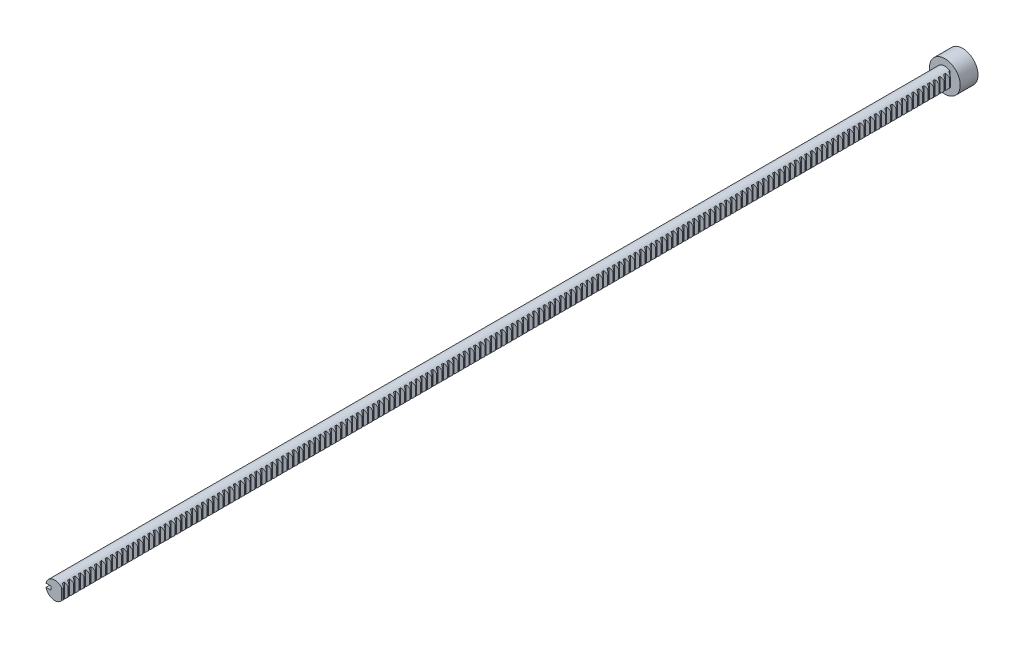
from build123d import *

# Parameters (mm, degrees)
BOSS_EXTRUDE1_DEPTH = 250
CUT_EXTRUDE3_DEPTH  = 255.066920318
LPATTERN1_COUNT     = 200
LPATTERN1_PITCH     = 3
SKETCH3_R           = 8.647763434
BOSS_EXTRUDE2_DEPTH = 10


with BuildPart() as part:
    # Sketch1 → Boss-Extrude1 (new, symmetric)
    with BuildSketch(Plane.XY):
        with BuildLine():
            Line((-2, 41), (-4.898979486, 41))
            ThreePointArc((-4.898979486, 41), (5, 40), (-4.898979486, 39))
            Line((-4.898979486, 39), (-2, 39))
            Line((-2, 39), (-2, 41))
        make_face()
    extrude(amount=BOSS_EXTRUDE1_DEPTH, both=True)

    # Sketch2 → Cut-Extrude3 (cut, symmetric)
    with BuildSketch(Plane(origin=(0, 0, 0), x_dir=(1, 0, 0), z_dir=(0, 1, 0))):
        Polygon((2.818391594, 250), (2.818391594, 249.457344914), (4.335297657, 248.75), (4.335297657, 248.25), (2.818391594, 247.542655086), (2.818391594, 247), (7.094539398, 247), (7.094539398, 250), align=None)
    cut_extrude3 = extrude(amount=CUT_EXTRUDE3_DEPTH, both=True, mode=Mode.SUBTRACT)

    # LPattern1: Cut-Extrude3 ×200
    with Locations(*[(0, 0, i * LPATTERN1_PITCH) for i in range(1, LPATTERN1_COUNT)]):
        add(cut_extrude3, mode=Mode.SUBTRACT)

    # Sketch3 → Boss-Extrude2 (add)
    with BuildSketch(Plane(origin=(0, 0, -250), x_dir=(-1, 0, 0), z_dir=(0, 0, -1))):
        with Locations((0, 40)):
            Circle(SKETCH3_R)
    extrude(amount=BOSS_EXTRUDE2_DEPTH)


solid = part.part
